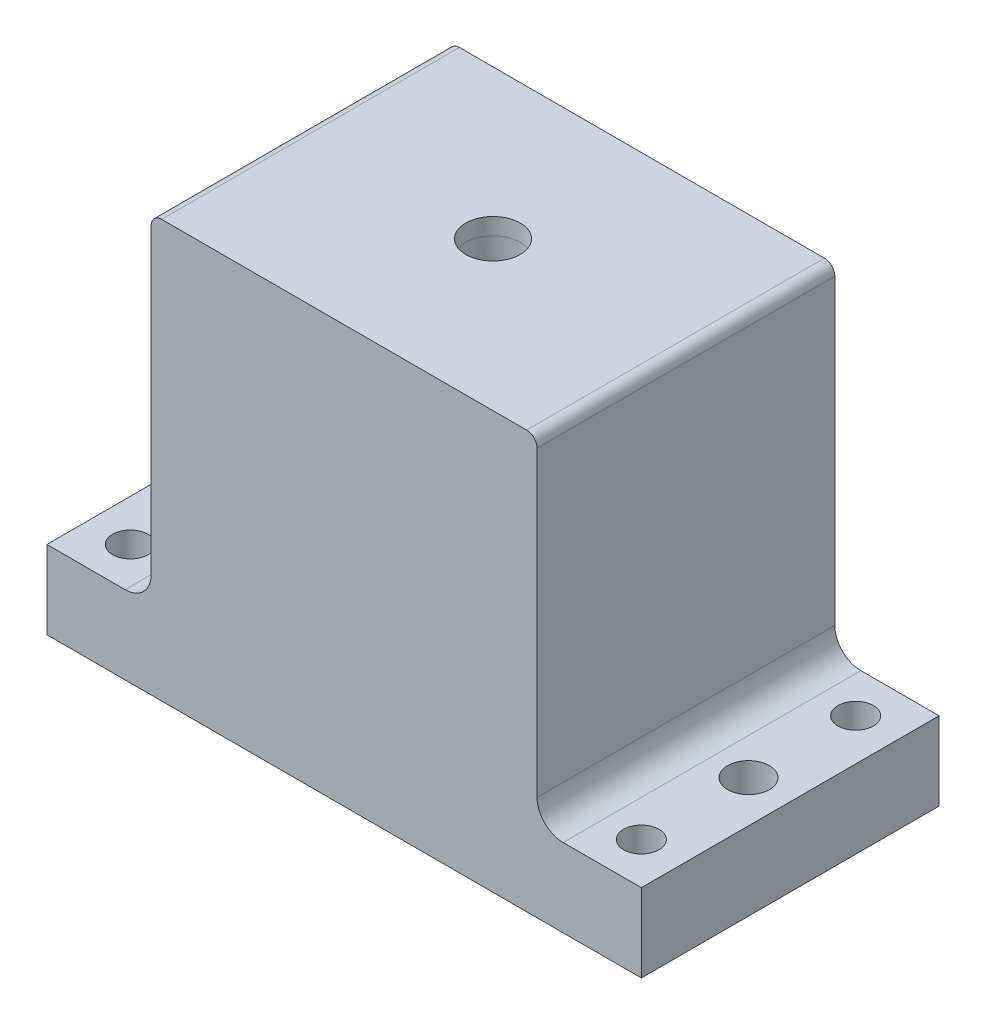
from build123d import *

# Parameters (mm, degrees)
SKETCH1_W             = 74
SKETCH1_H             = 57.1
BOSS_EXTRUDE1_DEPTH   = 80
FILLET1_R             = 2
CUT_EXTRUDE1_REACH    = 94.65
SKETCH2_R             = 5.23
SKETCH7_W             = 20
SKETCH7_H             = 57.1
BOSS_EXTRUDE2_DEPTH   = 15
M8_TAPPED_HOLE1_D     = 6.8
FILLET2_R             = 5
F_8_0MM_DOWEL_HOLE1_D = 8


# Read off the part's stored shape, not the designer's step: Draft1
with BuildPart() as part:
    # Sketch1 → Boss-Extrude1 (new body)
    with BuildSketch(Plane(origin=(0, 0, 0), x_dir=(1, 0, 0), z_dir=(0, 1, 0))):
        Rectangle(SKETCH1_W, SKETCH1_H)
    extrude(amount=BOSS_EXTRUDE1_DEPTH)

    # Fillet1
    fillet1_edges = [part.edges().sort_by_distance(p)[0] for p in [
        (-37, 80, 0),
        (37, 80, 0),
    ]]
    fillet(fillet1_edges, radius=FILLET1_R)

    # Sketch2 → Cut-Extrude1 (cut, up to next)
    with BuildSketch(Plane(origin=(0, 80, 0), x_dir=(1, 0, 0), z_dir=(0, 1, 0)), mode=Mode.PRIVATE) as cut_extrude1_sk1:
        with Locations(Location((0, 0, 0), (0, 0, 270))):
            Circle(SKETCH2_R)
    cut_extrude1_tool1 = extrude(cut_extrude1_sk1.sketch, amount=-CUT_EXTRUDE1_REACH, mode=Mode.PRIVATE) & part.part
    add(cut_extrude1_tool1.solids().sort_by_distance((0, 80, 0))[0], mode=Mode.SUBTRACT)

    # Draft1 outline → Draft1 (revolve, cut)
    with BuildSketch(Plane.XY):
        Polygon((6.570548986, 0), (5.23, 76.8), (5.23, 0), align=None)
    revolve(axis=Axis((0, 0, 0), (0, 1, 0)), mode=Mode.SUBTRACT)

    # Sketch7 → Boss-Extrude2 (add)
    with BuildSketch(Plane.XZ):
        with Locations((-47, 0)):
            Rectangle(SKETCH7_W, SKETCH7_H)
    boss_extrude2 = extrude(amount=-BOSS_EXTRUDE2_DEPTH)

    # Mirror1: Boss-Extrude2 across plane
    add(boss_extrude2.mirror(Plane(origin=(0, 0, 0), x_dir=(0, 0, 1), z_dir=(1, 0, 0))))

    # M8 Tapped Hole1 (through all)
    with Locations(Plane(origin=(0, 0, 0), x_dir=(-1, 0, 0), z_dir=(0, -1, 0))):
        with Locations((-49, 20.55), (49, 20.55), (49, -20.55), (-49, -20.55)):
            Hole(M8_TAPPED_HOLE1_D / 2)

    # Fillet2
    fillet2_edges = [part.edges().sort_by_distance(p)[0] for p in [
        (-37, 15, 0),
        (37, 15, 0),
    ]]
    fillet(fillet2_edges, radius=FILLET2_R)

    # Ø8.0mm Dowel Hole1 (through all)
    with Locations(Plane(origin=(0, 0, 0), x_dir=(-1, 0, 0), z_dir=(0, -1, 0))):
        with Locations((-49, 0), (49, 0)):
            Hole(F_8_0MM_DOWEL_HOLE1_D / 2)


solid = part.part
